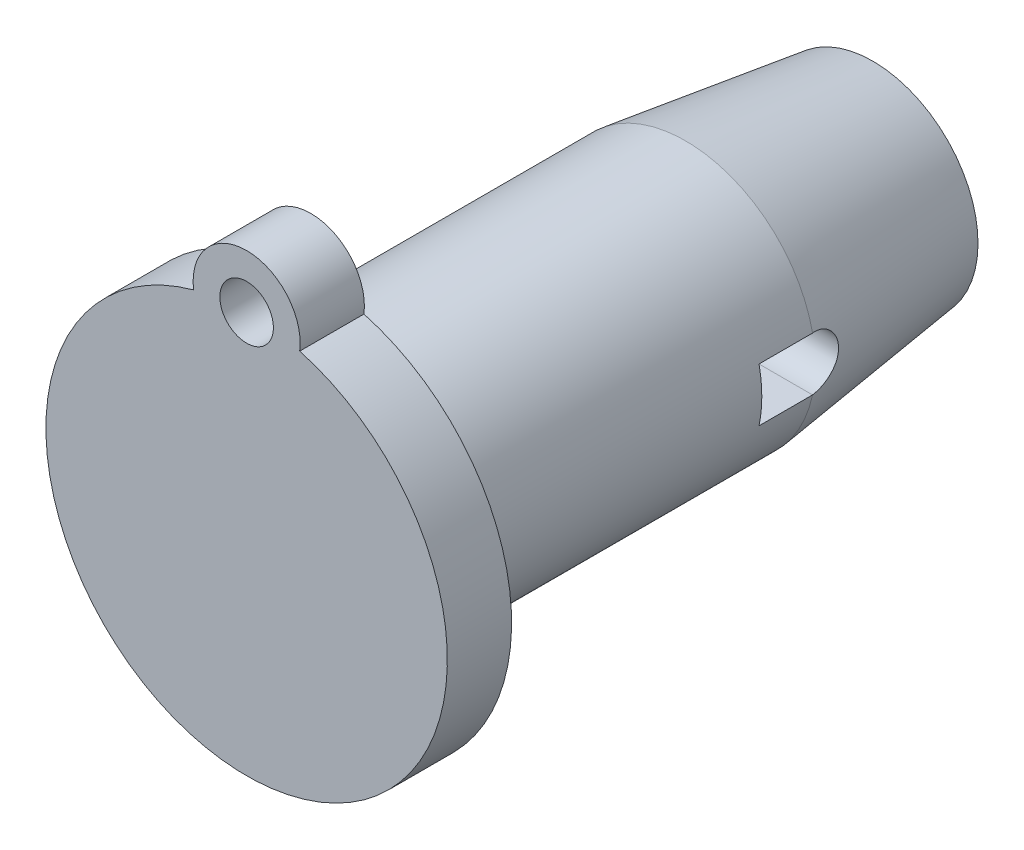
from build123d import *

# Parameters (mm, degrees)
SKETCH_1_R          = 37.5
EXTRUDE_1_DEPTH     = 12
SKETCH_2_R          = 24.25
EXTRUDE_2_DEPTH     = 105
CHAMFER_1_SIZE      = 35
CHAMFER_1_SIZE2     = 4.607837416
CUT_EXTRUDE_3_DEPTH = 178.024009671
SKETCH_6_R          = 10
EXTRUDE_4_DEPTH     = 12
SKETCH_7_R          = 5
CUT_EXTRUDE_5_DEPTH = 122.191996522


with BuildPart() as part:
    # 草图1 → 拉伸1 (new body)
    with BuildSketch(Plane.XY):
        Circle(SKETCH_1_R)
    extrude(amount=EXTRUDE_1_DEPTH)

    # 草图2 → 拉伸2 (add)
    with BuildSketch(Plane(origin=(0, 0, 0), x_dir=(-1, 0, 0), z_dir=(0, 0, -1))):
        Circle(SKETCH_2_R)
    extrude(amount=EXTRUDE_2_DEPTH)

    # 倒角1
    chamfer_1_edges = [part.edges().sort_by_distance(p)[0] for p in [
        (24.25, 0, -105),
    ]]
    chamfer_1_side = [part.faces().sort_by_distance(p)[0] for p in [
        (24.25, 0, -52.5),
    ]]
    chamfer(chamfer_1_edges, length=CHAMFER_1_SIZE, length2=CHAMFER_1_SIZE2, reference=chamfer_1_side[0])

    # 草图3 → 拉伸3 (cut, through all)
    with BuildSketch(Plane(origin=(100, 0, 0), x_dir=(0, 0, -1), z_dir=(1, 0, 0))):
        with BuildLine():
            Line((60, 5), (70, 5))
            ThreePointArc((70, 5), (75, 0), (70, -5))
            Line((70, -5), (60, -5))
            Line((60, -5), (60, 5))
        make_face()
    extrude(amount=-CUT_EXTRUDE_3_DEPTH, mode=Mode.SUBTRACT)

    # 草图6 → 拉伸4 (add)
    with BuildSketch(Plane(origin=(0, 0, 0), x_dir=(-1, 0, 0), z_dir=(0, 0, -1))):
        with Locations((0, 37.5)):
            Circle(SKETCH_6_R)
    extrude(amount=-EXTRUDE_4_DEPTH)

    # 草图7 → 拉伸5 (cut, through all)
    with BuildSketch(Plane(origin=(0, 0, 0), x_dir=(-1, 0, 0), z_dir=(0, 0, -1))):
        with Locations((0, 37.5)):
            Circle(SKETCH_7_R)
    extrude(amount=-CUT_EXTRUDE_5_DEPTH, mode=Mode.SUBTRACT)


solid = part.part
